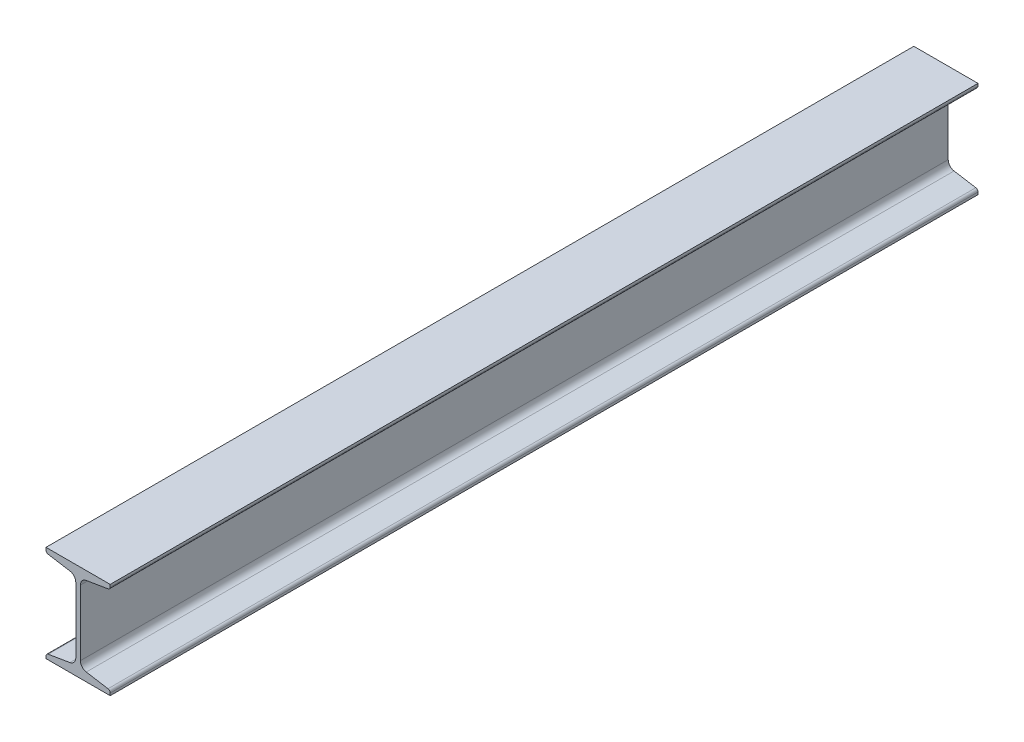
from build123d import *

# Parameters (mm, degrees)
BASESBEAM_DEPTH = 457.2
TOEFILLET_R     = 2.794


with BuildPart() as part:
    # Sketch1 → BaseSbeam (new, symmetric)
    with BuildSketch(Plane.XY):
        with BuildLine():
            Line((0, 0), (0, 4.82792597))
            Line((0, 4.82792597), (25.214048892, 9.030574012))
            ThreePointArc((25.214048892, 9.030574012), (29.623433353, 11.535173088), (31.369, 16.296337329))
            Line((31.369, 16.296337329), (31.369, 85.303662671))
            ThreePointArc((31.369, 85.303662671), (29.623433353, 90.064826912), (25.214048892, 92.569425988))
            Line((25.214048892, 92.569425988), (0, 96.77207403))
            Line((0, 96.77207403), (0, 101.6))
            Line((0, 101.6), (67.6402, 101.6))
            Line((67.6402, 101.6), (67.6402, 96.77207403))
            Line((67.6402, 96.77207403), (42.426151108, 92.569425988))
            ThreePointArc((42.426151108, 92.569425988), (38.016766647, 90.064826912), (36.2712, 85.303662671))
            Line((36.2712, 85.303662671), (36.2712, 16.296337329))
            ThreePointArc((36.2712, 16.296337329), (38.016766647, 11.535173088), (42.426151108, 9.030574012))
            Line((42.426151108, 9.030574012), (67.6402, 4.82792597))
            Line((67.6402, 4.82792597), (67.6402, 0))
            Line((67.6402, 0), (0, 0))
        make_face()
    extrude(amount=BASESBEAM_DEPTH, both=True)

    # ToeFillet
    toefillet_edges = [part.edges().sort_by_distance(p)[0] for p in [
        (67.6402, 4.82792597, 0),
        (0, 4.82792597, 0),
        (67.6402, 96.77207403, 0),
        (0, 96.77207403, 0),
    ]]
    fillet(toefillet_edges, radius=TOEFILLET_R)


solid = part.part
